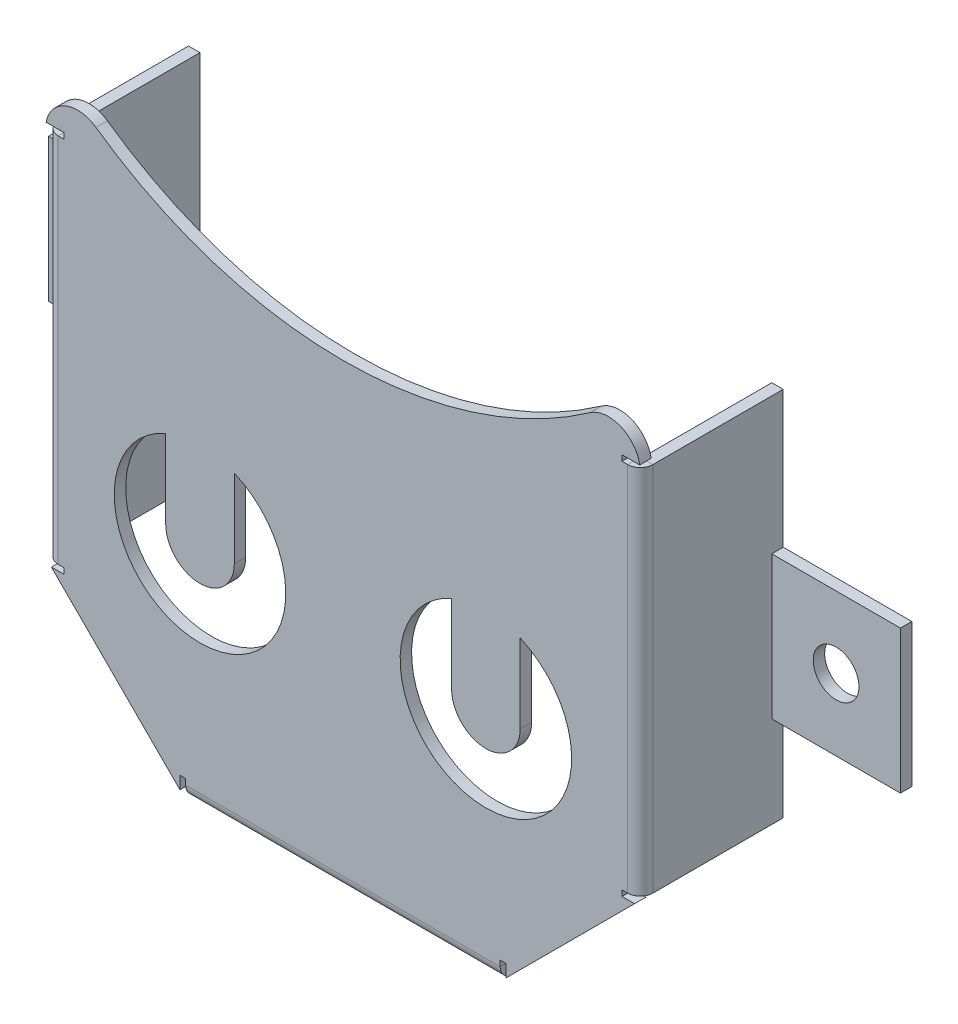
from build123d import *

# Parameters (mm, degrees)
BASE_FLANGE1_DEPTH              = 0.254
EDGE_FLANGE1_STRIP_W            = 1.0668
EDGE_FLANGE1_STRIP_H            = 0.254
EDGE_FLANGE1_STRIP_CUT_DEPTH    = 6.985
EDGE_FLANGE1_RELIEF_W           = 1.1938
EDGE_FLANGE1_RELIEF_H           = 0.127
EDGE_FLANGE1_RELIEF_CUT_DEPTH   = 0.254
EDGE_FLANGE1_DEPTH              = 6.985
EDGE_FLANGE2_STRIP_W            = 1.0668
EDGE_FLANGE2_STRIP_H            = 0.254
EDGE_FLANGE2_STRIP_CUT_DEPTH    = 8.244248495
EDGE_FLANGE2_RELIEF_W           = 1.1938
EDGE_FLANGE2_RELIEF_H           = 0.127
EDGE_FLANGE2_RELIEF_CUT_DEPTH   = 0.254
EDGE_FLANGE2_STRIP_2_W          = 1.0668
EDGE_FLANGE2_STRIP_2_H          = 0.254
EDGE_FLANGE2_STRIP_CUT_2_DEPTH  = 8.244248495
EDGE_FLANGE2_RELIEF_2_W         = 1.1938
EDGE_FLANGE2_RELIEF_2_H         = 0.127
EDGE_FLANGE2_RELIEF_CUT_2_DEPTH = 0.254
EDGE_FLANGE2_DEPTH              = 8.244248495
EDGE_FLANGE2_BEND_DEPTH         = 8.244248495
EXTRUDE_THIN1_START             = -1.5875
EXTRUDE_THIN1_OUTLINE_W         = 2.8575
EXTRUDE_THIN1_OUTLINE_H         = 0.254
EXTRUDE_THIN1_DEPTH             = 3.175
CUT_EXTRUDE1_REACH              = 22.35
CUT_EXTRUDE2_REACH              = 22.35
SKETCH23_R                      = 0.508


# Read off the part's stored shape, not the designer's step: Extrude-Thin1
# Sheet-metal steps are written as plain solids
with BuildPart() as part:
    # Sketch1 → Base-Flange1 (new body)
    with BuildSketch(Plane.XY):
        with BuildLine():
            Line((3.123097979, 0), (10.108097979, 0))
            Line((10.108097979, 0), (13.219597979, 3.1115))
            Line((13.219597979, 3.1115), (13.219597979, 11.355748495))
            ThreePointArc((13.219597979, 11.355748495), (12.836917178, 11.985343025), (12.101830107, 11.935534727))
            ThreePointArc((12.101830107, 11.935534727), (6.615597979, 10.196861335), (1.129365852, 11.935534727))
            ThreePointArc((1.129365852, 11.935534727), (0.39427878, 11.985343025), (0.011597979, 11.355748495))
            Line((0.011597979, 11.355748495), (0.011597979, 3.1115))
            Line((0.011597979, 3.1115), (3.123097979, 0))
        make_face()
    extrude(amount=-BASE_FLANGE1_DEPTH)

    # Edge-Flange1 strip (across the edge) → Edge-Flange1 strip cut (cut)
    with BuildSketch(Plane(origin=(10.108097979, 0, -0.254), x_dir=(0, 1, 0), z_dir=(-1, 0, 0))):
        with Locations((-0.254, -0.127)):
            Rectangle(EDGE_FLANGE1_STRIP_W, EDGE_FLANGE1_STRIP_H)
    extrude(amount=EDGE_FLANGE1_STRIP_CUT_DEPTH, mode=Mode.SUBTRACT)

    # Edge-Flange1 relief (on the sheet) → Edge-Flange1 relief cut (cut)
    with BuildSketch(Plane(origin=(10.108097979, 0.2794, -0.254), x_dir=(0, 1, 0), z_dir=(0, 0, -1))):
        with Locations((-0.4699, 0.0635)):
            Rectangle(EDGE_FLANGE1_RELIEF_W, EDGE_FLANGE1_RELIEF_H)
        with Locations((-0.4699, -7.0485)):
            Rectangle(EDGE_FLANGE1_RELIEF_W, EDGE_FLANGE1_RELIEF_H)
    extrude(amount=-EDGE_FLANGE1_RELIEF_CUT_DEPTH, mode=Mode.SUBTRACT)

    # Edge-Flange1 section (across the edge) → Edge-Flange1 (add)
    with BuildSketch(Plane(origin=(10.108097979, 0, -0.254), x_dir=(0, 1, 0), z_dir=(-1, 0, 0))):
        with BuildLine():
            Line((0, 0.0254), (0, 1.778))
            Line((0, 1.778), (0.254, 1.778))
            Line((0.254, 1.778), (0.254, 0.0254))
            ThreePointArc((0.254, 0.0254), (0.261439488, 0.007439488), (0.2794, 0))
            Line((0.2794, 0), (0.2794, -0.254))
            ThreePointArc((0.2794, -0.254), (0.081834365, -0.172165635), (0, 0.0254))
        make_face()
    extrude(amount=EDGE_FLANGE1_DEPTH)

    # Edge-Flange2 strip (across the edge) → Edge-Flange2 strip cut (cut)
    with BuildSketch(Plane(origin=(0.011597979, 3.1115, -0.254), x_dir=(1, 0, 0), z_dir=(0, 1, 0))):
        with Locations((-0.254, -0.127)):
            Rectangle(EDGE_FLANGE2_STRIP_W, EDGE_FLANGE2_STRIP_H)
    extrude(amount=EDGE_FLANGE2_STRIP_CUT_DEPTH, mode=Mode.SUBTRACT)

    # Edge-Flange2 relief (on the sheet) → Edge-Flange2 relief cut (cut)
    with BuildSketch(Plane(origin=(0.290997979, 3.1115, -0.254), x_dir=(1, 0, 0), z_dir=(0, 0, -1))):
        with Locations((-0.4699, 0.0635)):
            Rectangle(EDGE_FLANGE2_RELIEF_W, EDGE_FLANGE2_RELIEF_H)
        with Locations((-0.4699, -8.307748495)):
            Rectangle(EDGE_FLANGE2_RELIEF_W, EDGE_FLANGE2_RELIEF_H)
    extrude(amount=-EDGE_FLANGE2_RELIEF_CUT_DEPTH, mode=Mode.SUBTRACT)

    # Edge-Flange2 strip 2 (across the edge) → Edge-Flange2 strip cut 2 (cut)
    with BuildSketch(Plane(origin=(13.219597979, 11.355748495, -0.254), x_dir=(-1, 0, 0), z_dir=(0, -1, 0))):
        with Locations((-0.254, -0.127)):
            Rectangle(EDGE_FLANGE2_STRIP_2_W, EDGE_FLANGE2_STRIP_2_H)
    extrude(amount=EDGE_FLANGE2_STRIP_CUT_2_DEPTH, mode=Mode.SUBTRACT)

    # Edge-Flange2 relief 2 (on the sheet) → Edge-Flange2 relief cut 2 (cut)
    with BuildSketch(Plane(origin=(12.940197979, 11.355748495, -0.254), x_dir=(-1, 0, 0), z_dir=(0, 0, -1))):
        with Locations((-0.4699, 0.0635)):
            Rectangle(EDGE_FLANGE2_RELIEF_2_W, EDGE_FLANGE2_RELIEF_2_H)
        with Locations((-0.4699, -8.307748495)):
            Rectangle(EDGE_FLANGE2_RELIEF_2_W, EDGE_FLANGE2_RELIEF_2_H)
    extrude(amount=-EDGE_FLANGE2_RELIEF_CUT_2_DEPTH, mode=Mode.SUBTRACT)

    # Edge-Flange2 section (across the edge) → Edge-Flange2 (add)
    with BuildSketch(Plane(origin=(0.011597979, 3.1115, -0.254), x_dir=(1, 0, 0), z_dir=(0, 1, 0))):
        with BuildLine():
            Line((0, 0.0254), (0, 2.921))
            Line((0, 2.921), (0.254, 2.921))
            Line((0.254, 2.921), (0.254, 0.0254))
            ThreePointArc((0.254, 0.0254), (0.261439488, 0.007439488), (0.2794, 0))
            Line((0.2794, 0), (0.2794, -0.254))
            ThreePointArc((0.2794, -0.254), (0.081834365, -0.172165635), (0, 0.0254))
        make_face()
    extrude(amount=EDGE_FLANGE2_DEPTH)

    # Edge-Flange2 section 2 (across the edge) → Edge-Flange2 bend (add)
    with BuildSketch(Plane(origin=(13.219597979, 11.355748495, -0.254), x_dir=(-1, 0, 0), z_dir=(0, -1, 0))):
        with BuildLine():
            Line((0, 0.0254), (0, 2.921))
            Line((0, 2.921), (0.254, 2.921))
            Line((0.254, 2.921), (0.254, 0.0254))
            ThreePointArc((0.254, 0.0254), (0.261439488, 0.007439488), (0.2794, 0))
            Line((0.2794, 0), (0.2794, -0.254))
            ThreePointArc((0.2794, -0.254), (0.081834365, -0.172165635), (0, 0.0254))
        make_face()
    extrude(amount=EDGE_FLANGE2_BEND_DEPTH)

    # Extrude-Thin1 outline → Extrude-Thin1 (add)
    with BuildSketch(Plane(origin=(0, 6.731, 0), x_dir=(-1, 0, 0), z_dir=(0, -1, 0)).offset(EXTRUDE_THIN1_START)):
        with Locations((1.417152021, 3.048)):
            Rectangle(EXTRUDE_THIN1_OUTLINE_W, EXTRUDE_THIN1_OUTLINE_H)
        with Locations((-14.648347979, 3.048)):
            Rectangle(EXTRUDE_THIN1_OUTLINE_W, EXTRUDE_THIN1_OUTLINE_H)
    extrude(amount=EXTRUDE_THIN1_DEPTH)

    # Sketch20 → Cut-Extrude1 (cut, up to next)
    with BuildSketch(Plane.XY, mode=Mode.PRIVATE) as cut_extrude1_sk1:
        with BuildLine():
            Line((2.678597979, 6.82596134), (2.678597979, 5.08))
            ThreePointArc((2.678597979, 5.08), (3.440597979, 4.318), (4.202597979, 5.08))
            Line((4.202597979, 5.08), (4.202597979, 6.82596134))
            ThreePointArc((4.202597979, 6.82596134), (3.440597979, 3.175), (2.678597979, 6.82596134))
        make_face()
    cut_extrude1_tool1 = extrude(cut_extrude1_sk1.sketch, amount=-CUT_EXTRUDE1_REACH, mode=Mode.PRIVATE) & part.part
    # Sketch20 → Cut-Extrude1 (cut, up to next)
    with BuildSketch(Plane.XY, mode=Mode.PRIVATE) as cut_extrude1_sk2:
        with BuildLine():
            Line((9.028597979, 6.82596134), (9.028597979, 5.08))
            ThreePointArc((9.028597979, 5.08), (9.790597979, 4.318), (10.552597979, 5.08))
            Line((10.552597979, 5.08), (10.552597979, 6.82596134))
            ThreePointArc((10.552597979, 6.82596134), (9.790597979, 3.175), (9.028597979, 6.82596134))
        make_face()
    cut_extrude1_tool2 = extrude(cut_extrude1_sk2.sketch, amount=-CUT_EXTRUDE1_REACH, mode=Mode.PRIVATE) & part.part
    add(cut_extrude1_tool1.solids().sort_by_distance((2.625829, 5.952981, 0))[0], mode=Mode.SUBTRACT)
    add(cut_extrude1_tool2.solids().sort_by_distance((10.605367, 5.952981, 0))[0], mode=Mode.SUBTRACT)

    # Sketch23 → Cut-Extrude2 (cut, up to next)
    with BuildSketch(Plane(origin=(0, 0, -3.175), x_dir=(-1, 0, 0), z_dir=(0, 0, -1)), mode=Mode.PRIVATE) as cut_extrude2_sk1:
        with Locations((-14.648347979, 6.731)):
            Circle(SKETCH23_R)
    cut_extrude2_tool1 = extrude(cut_extrude2_sk1.sketch, amount=-CUT_EXTRUDE2_REACH, mode=Mode.PRIVATE) & part.part
    # Sketch23 → Cut-Extrude2 (cut, up to next)
    with BuildSketch(Plane(origin=(0, 0, -3.175), x_dir=(-1, 0, 0), z_dir=(0, 0, -1)), mode=Mode.PRIVATE) as cut_extrude2_sk2:
        with Locations((1.417152021, 6.731)):
            Circle(SKETCH23_R)
    cut_extrude2_tool2 = extrude(cut_extrude2_sk2.sketch, amount=-CUT_EXTRUDE2_REACH, mode=Mode.PRIVATE) & part.part
    add(cut_extrude2_tool1.solids().sort_by_distance((14.648348, 6.731, -3.175))[0], mode=Mode.SUBTRACT)
    add(cut_extrude2_tool2.solids().sort_by_distance((-1.417152, 6.731, -3.175))[0], mode=Mode.SUBTRACT)


solid = part.part
